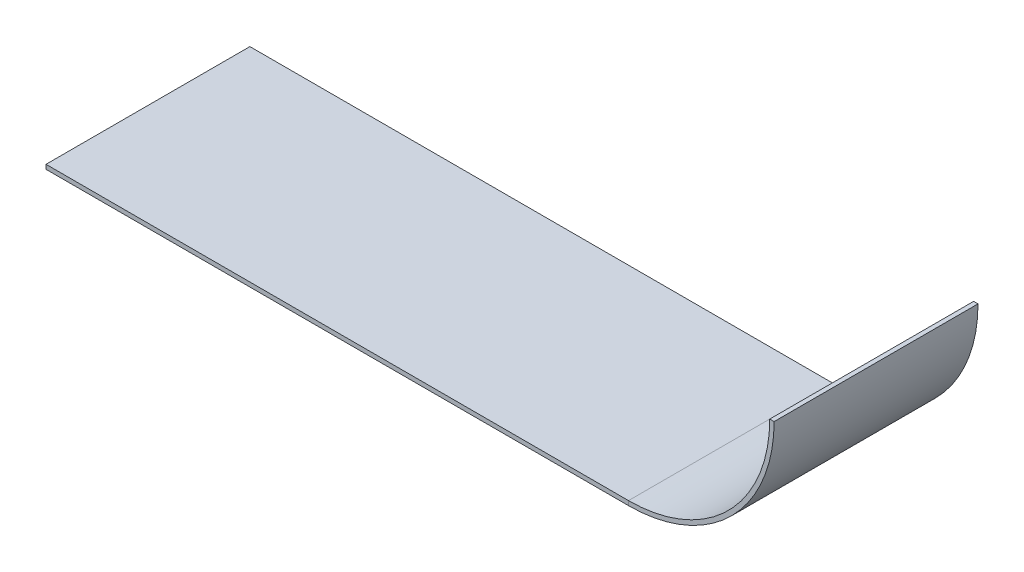
from build123d import *

# Parameters (mm, degrees)
SM_BASE_FLANGE_1_DEPTH = 70


# Sheet-metal steps are written as plain solids
with BuildPart() as part:
    # Sketch 1 → 基体-法兰1 (new body)
    with BuildSketch(Plane.XY):
        with BuildLine():
            Line((0, 0), (200, 0))
            ThreePointArc((200, 0), (235.355339059, 14.644660941), (250, 50))
            Line((250, 50), (248.5, 50))
            ThreePointArc((248.5, 50), (234.294678888, 15.705321112), (200, 1.5))
            Line((200, 1.5), (0, 1.5))
            Line((0, 1.5), (0, 0))
        make_face()
    extrude(amount=SM_BASE_FLANGE_1_DEPTH)


solid = part.part
